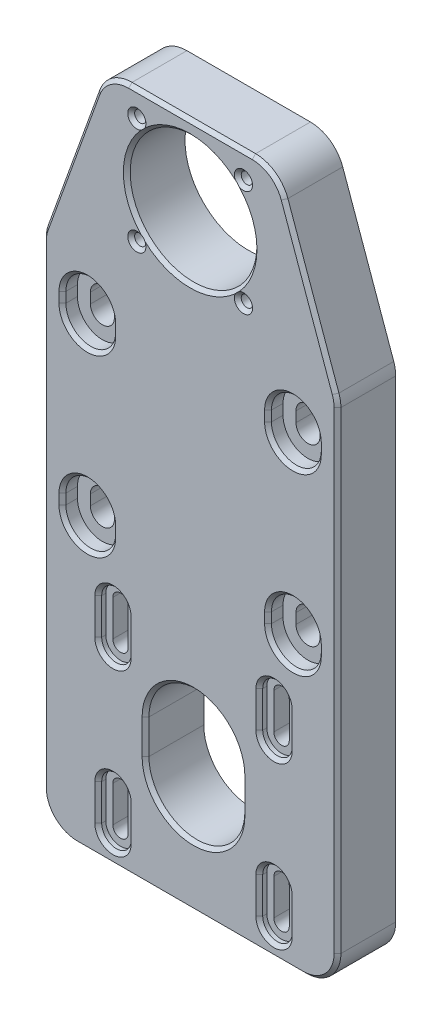
from build123d import *

# Parameters (mm, degrees)
SKETCH1_R                                = 18.5
SKETCH1_W                                = 86
SKETCH1_H                                = 77
SKETCH1_H_2                              = 72.733642247
BOSS_EXTRUDE1_DEPTH                      = 17
M4X0_7_TAPPED_HOLE1_D                    = 3.3
M4X0_7_TAPPED_HOLE1_DEPTH                = 20
M4X0_7_TAPPED_HOLE1_TIP                  = 0.991420021
CBORE_SLOT_FOR_M4_SBHCS3_DEPTH           = 17
CBORE_START                              = 14.8
CBORE_SLOT_FOR_M4_SBHCS3_2_DEPTH         = 2.2
CUT_EXTRUDE1_DEPTH                       = 138.03649149
CBORE_SLOT_FOR_M6_HEX_HEAD_BOLT1_DEPTH   = 17
CBORE_START_2                            = 12.62
CBORE_SLOT_FOR_M6_HEX_HEAD_BOLT1_2_DEPTH = 4.38
FILLET1_R                                = 10
CHAMFER1_SIZE                            = 1


# Read off the part's stored shape, not the designer's step: CBORE SLOT for M4 SBHCS3, CBORE SLOT for M6 Hex Head Bolt1
with BuildPart() as part:
    # Sketch1 → Boss-Extrude1 (new body)
    # profile 1 of 3: a face of its own
    with BuildSketch(Plane.XY):
        Polygon((14.773286703, 129), (-14.773286703, 129), (-24.97132573, 129), (-43, 79), (43, 79), (25.15845151, 129), (20.15845151, 129), align=None)
        with Locations((0, 106)):
            Circle(SKETCH1_R, mode=Mode.SUBTRACT)
    # profile 2 of 3: a face of its own
    with BuildSketch(Plane.XY):
        with Locations((0, 40.5)):
            Rectangle(SKETCH1_W, SKETCH1_H)
    # profile 3 of 3: a face of its own
    with BuildSketch(Plane.XY):
        with Locations((0, -34.366821124)):
            Rectangle(SKETCH1_W, SKETCH1_H_2)
    extrude(amount=BOSS_EXTRUDE1_DEPTH)

    # M4x0.7 Tapped Hole1
    with Locations(Plane(origin=(-15.556349182, 90.443650818, 17), x_dir=(1, 0, 0), z_dir=(0, 0, 1))):
        with Locations((0, 0), (0, 31.112698364), (31.112698364, 31.112698364), (31.112698364, 0)):
            Hole(M4X0_7_TAPPED_HOLE1_D / 2, depth=M4X0_7_TAPPED_HOLE1_DEPTH)
            with Locations((0, 0, -(M4X0_7_TAPPED_HOLE1_DEPTH + M4X0_7_TAPPED_HOLE1_TIP / 2))):  # 118° drill point
                Cone(0, M4X0_7_TAPPED_HOLE1_D / 2, M4X0_7_TAPPED_HOLE1_TIP, mode=Mode.SUBTRACT)

    # CBORE SLOT for M4 SBHCS3 outline → CBORE SLOT for M4 SBHCS3 (cut)
    with BuildSketch(Plane.XY):
        with BuildLine():
            ThreePointArc((-20.274967442, -52.200025), (-22.524967442, -49.950025), (-24.774967442, -52.200025))
            Line((-24.774967442, -52.200025), (-24.774967442, -62.700025))
            ThreePointArc((-24.774967442, -62.700025), (-22.524967442, -64.950025), (-20.274967442, -62.700025))
            Line((-20.274967442, -62.700025), (-20.274967442, -52.200025))
        make_face()
        with BuildLine():
            ThreePointArc((-20.274967442, -5.200025), (-22.524967442, -2.950025), (-24.774967442, -5.200025))
            Line((-24.774967442, -5.200025), (-24.774967442, -15.700025))
            ThreePointArc((-24.774967442, -15.700025), (-22.524967442, -17.950025), (-20.274967442, -15.700025))
            Line((-20.274967442, -15.700025), (-20.274967442, -5.200025))
        make_face()
        with BuildLine():
            ThreePointArc((22.225032558, -62.700025), (24.475032558, -64.950025), (26.725032558, -62.700025))
            Line((26.725032558, -62.700025), (26.725032558, -52.200025))
            ThreePointArc((26.725032558, -52.200025), (24.475032558, -49.950025), (22.225032558, -52.200025))
            Line((22.225032558, -52.200025), (22.225032558, -62.700025))
        make_face()
        with BuildLine():
            ThreePointArc((22.225032558, -15.700025), (24.475032558, -17.950025), (26.725032558, -15.700025))
            Line((26.725032558, -15.700025), (26.725032558, -5.200025))
            ThreePointArc((26.725032558, -5.200025), (24.475032558, -2.950025), (22.225032558, -5.200025))
            Line((22.225032558, -5.200025), (22.225032558, -15.700025))
        make_face()
    extrude(amount=CBORE_SLOT_FOR_M4_SBHCS3_DEPTH, mode=Mode.SUBTRACT)

    # CBORE SLOT for M4 SBHCS3 2 outline → CBORE SLOT for M4 SBHCS3 2 (cut)
    # profile 1 of 4: a face of its own
    with BuildSketch(Plane.XY.offset(CBORE_START)):
        with BuildLine():
            Line((-18.224967442, -62.700025), (-18.224967442, -52.200025))
            ThreePointArc((-18.224967442, -52.200025), (-22.524967442, -47.900025), (-26.824967442, -52.200025))
            Line((-26.824967442, -52.200025), (-26.824967442, -62.700025))
            ThreePointArc((-26.824967442, -62.700025), (-22.524967442, -67.000025), (-18.224967442, -62.700025))
        make_face()
        with BuildLine():
            Line((-24.774967442, -62.700025), (-24.774967442, -52.200025))
            ThreePointArc((-24.774967442, -52.200025), (-22.524967442, -49.950025), (-20.274967442, -52.200025))
            Line((-20.274967442, -52.200025), (-20.274967442, -62.700025))
            ThreePointArc((-20.274967442, -62.700025), (-22.524967442, -64.950025), (-24.774967442, -62.700025))
        make_face(mode=Mode.SUBTRACT)
    # profile 2 of 4: a face of its own
    with BuildSketch(Plane.XY.offset(CBORE_START)):
        with BuildLine():
            ThreePointArc((-18.224967442, -5.200025), (-22.524967442, -0.900025), (-26.824967442, -5.200025))
            Line((-26.824967442, -5.200025), (-26.824967442, -15.700025))
            ThreePointArc((-26.824967442, -15.700025), (-22.524967442, -20.000025), (-18.224967442, -15.700025))
            Line((-18.224967442, -15.700025), (-18.224967442, -5.200025))
        make_face()
        with BuildLine():
            Line((-24.774967442, -15.700025), (-24.774967442, -5.200025))
            ThreePointArc((-24.774967442, -5.200025), (-22.524967442, -2.950025), (-20.274967442, -5.200025))
            Line((-20.274967442, -5.200025), (-20.274967442, -15.700025))
            ThreePointArc((-20.274967442, -15.700025), (-22.524967442, -17.950025), (-24.774967442, -15.700025))
        make_face(mode=Mode.SUBTRACT)
    # profile 3 of 4: a face of its own
    with BuildSketch(Plane.XY.offset(CBORE_START)):
        with BuildLine():
            Line((28.775032558, -62.700025), (28.775032558, -52.200025))
            ThreePointArc((28.775032558, -52.200025), (24.475032558, -47.900025), (20.175032558, -52.200025))
            Line((20.175032558, -52.200025), (20.175032558, -62.700025))
            ThreePointArc((20.175032558, -62.700025), (24.475032558, -67.000025), (28.775032558, -62.700025))
        make_face()
        with BuildLine():
            Line((26.725032558, -52.200025), (26.725032558, -62.700025))
            ThreePointArc((26.725032558, -62.700025), (24.475032558, -64.950025), (22.225032558, -62.700025))
            Line((22.225032558, -62.700025), (22.225032558, -52.200025))
            ThreePointArc((22.225032558, -52.200025), (24.475032558, -49.950025), (26.725032558, -52.200025))
        make_face(mode=Mode.SUBTRACT)
    # profile 4 of 4: a face of its own
    with BuildSketch(Plane.XY.offset(CBORE_START)):
        with BuildLine():
            ThreePointArc((28.775032558, -5.200025), (24.475032558, -0.900025), (20.175032558, -5.200025))
            Line((20.175032558, -5.200025), (20.175032558, -15.700025))
            ThreePointArc((20.175032558, -15.700025), (24.475032558, -20.000025), (28.775032558, -15.700025))
            Line((28.775032558, -15.700025), (28.775032558, -5.200025))
        make_face()
        with BuildLine():
            Line((26.725032558, -5.200025), (26.725032558, -15.700025))
            ThreePointArc((26.725032558, -15.700025), (24.475032558, -17.950025), (22.225032558, -15.700025))
            Line((22.225032558, -15.700025), (22.225032558, -5.200025))
            ThreePointArc((22.225032558, -5.200025), (24.475032558, -2.950025), (26.725032558, -5.200025))
        make_face(mode=Mode.SUBTRACT)
    extrude(amount=CBORE_SLOT_FOR_M4_SBHCS3_2_DEPTH, mode=Mode.SUBTRACT)

    # Sketch13 → Cut-Extrude1 (cut, through all)
    with BuildSketch(Plane.XY.offset(17)):
        with BuildLine():
            Line((14.975032558, -28.950025), (14.975032558, -38.950025))
            ThreePointArc((14.975032558, -38.950025), (0.975032558, -52.950025), (-13.024967442, -38.950025))
            Line((-13.024967442, -38.950025), (-13.024967442, -28.950025))
            ThreePointArc((-13.024967442, -28.950025), (0.975032558, -14.950025), (14.975032558, -28.950025))
        make_face()
    extrude(amount=-CUT_EXTRUDE1_DEPTH, mode=Mode.SUBTRACT)

    # CBORE SLOT for M6 Hex Head Bolt1 outline → CBORE SLOT for M6 Hex Head Bolt1 (cut)
    with BuildSketch(Plane.XY):
        with BuildLine():
            ThreePointArc((33.5, 15.5), (30, 19), (26.5, 15.5))
            Line((26.5, 15.5), (26.5, 12.5))
            ThreePointArc((26.5, 12.5), (30, 9), (33.5, 12.5))
            Line((33.5, 12.5), (33.5, 15.5))
        make_face()
        with BuildLine():
            ThreePointArc((33.5, 66.5), (30, 70), (26.5, 66.5))
            Line((26.5, 66.5), (26.5, 63.5))
            ThreePointArc((26.5, 63.5), (30, 60), (33.5, 63.5))
            Line((33.5, 63.5), (33.5, 66.5))
        make_face()
        with BuildLine():
            ThreePointArc((-26.5, 15.5), (-30, 19), (-33.5, 15.5))
            Line((-33.5, 15.5), (-33.5, 12.5))
            ThreePointArc((-33.5, 12.5), (-30, 9), (-26.5, 12.5))
            Line((-26.5, 12.5), (-26.5, 15.5))
        make_face()
        with BuildLine():
            ThreePointArc((-26.5, 66.5), (-30, 70), (-33.5, 66.5))
            Line((-33.5, 66.5), (-33.5, 63.5))
            ThreePointArc((-33.5, 63.5), (-30, 60), (-26.5, 63.5))
            Line((-26.5, 63.5), (-26.5, 66.5))
        make_face()
    extrude(amount=CBORE_SLOT_FOR_M6_HEX_HEAD_BOLT1_DEPTH, mode=Mode.SUBTRACT)

    # CBORE SLOT for M6 Hex Head Bolt1 2 outli → CBORE SLOT for M6 Hex Head Bolt1 2 (cut)
    # profile 1 of 4: a face of its own
    with BuildSketch(Plane.XY.offset(CBORE_START_2)):
        with BuildLine():
            Line((37.275, 12.5), (37.275, 15.5))
            ThreePointArc((37.275, 15.5), (30, 22.775), (22.725, 15.5))
            Line((22.725, 15.5), (22.725, 12.5))
            ThreePointArc((22.725, 12.5), (30, 5.225), (37.275, 12.5))
        make_face()
        with BuildLine():
            Line((26.5, 12.5), (26.5, 15.5))
            ThreePointArc((26.5, 15.5), (30, 19), (33.5, 15.5))
            Line((33.5, 15.5), (33.5, 12.5))
            ThreePointArc((33.5, 12.5), (30, 9), (26.5, 12.5))
        make_face(mode=Mode.SUBTRACT)
    # profile 2 of 4: a face of its own
    with BuildSketch(Plane.XY.offset(CBORE_START_2)):
        with BuildLine():
            ThreePointArc((37.275, 66.5), (30, 73.775), (22.725, 66.5))
            Line((22.725, 66.5), (22.725, 63.5))
            ThreePointArc((22.725, 63.5), (30, 56.225), (37.275, 63.5))
            Line((37.275, 63.5), (37.275, 66.5))
        make_face()
        with BuildLine():
            Line((26.5, 63.5), (26.5, 66.5))
            ThreePointArc((26.5, 66.5), (30, 70), (33.5, 66.5))
            Line((33.5, 66.5), (33.5, 63.5))
            ThreePointArc((33.5, 63.5), (30, 60), (26.5, 63.5))
        make_face(mode=Mode.SUBTRACT)
    # profile 3 of 4: a face of its own
    with BuildSketch(Plane.XY.offset(CBORE_START_2)):
        with BuildLine():
            Line((-22.725, 12.5), (-22.725, 15.5))
            ThreePointArc((-22.725, 15.5), (-30, 22.775), (-37.275, 15.5))
            Line((-37.275, 15.5), (-37.275, 12.5))
            ThreePointArc((-37.275, 12.5), (-30, 5.225), (-22.725, 12.5))
        make_face()
        with BuildLine():
            Line((-33.5, 12.5), (-33.5, 15.5))
            ThreePointArc((-33.5, 15.5), (-30, 19), (-26.5, 15.5))
            Line((-26.5, 15.5), (-26.5, 12.5))
            ThreePointArc((-26.5, 12.5), (-30, 9), (-33.5, 12.5))
        make_face(mode=Mode.SUBTRACT)
    # profile 4 of 4: a face of its own
    with BuildSketch(Plane.XY.offset(CBORE_START_2)):
        with BuildLine():
            ThreePointArc((-22.725, 66.5), (-30, 73.775), (-37.275, 66.5))
            Line((-37.275, 66.5), (-37.275, 63.5))
            ThreePointArc((-37.275, 63.5), (-30, 56.225), (-22.725, 63.5))
            Line((-22.725, 63.5), (-22.725, 66.5))
        make_face()
        with BuildLine():
            Line((-33.5, 63.5), (-33.5, 66.5))
            ThreePointArc((-33.5, 66.5), (-30, 70), (-26.5, 66.5))
            Line((-26.5, 66.5), (-26.5, 63.5))
            ThreePointArc((-26.5, 63.5), (-30, 60), (-33.5, 63.5))
        make_face(mode=Mode.SUBTRACT)
    extrude(amount=CBORE_SLOT_FOR_M6_HEX_HEAD_BOLT1_2_DEPTH, mode=Mode.SUBTRACT)

    # Fillet1
    fillet1_edges = [part.edges().sort_by_distance(p)[0] for p in [
        (-43, 79, 8.5),
        (-24.97132573, 129, 8.5),
        (25.15845151, 129, 8.5),
        (43, 79, 8.5),
        (43, -70.733642247, 8.5),
        (-43, -70.733642247, 8.5),
    ]]
    fillet(fillet1_edges, radius=FILLET1_R)

    # Chamfer1
    # the kernel refuses this chamfer: 1 mm, written as the material it takes off along each edge
    with BuildSketch(Plane(origin=(28.775032558, -15.700025, 17), x_dir=(0.9996219169112968, 0, 0.027495876610585647), z_dir=(0, 1, 0)), Plane(origin=(20.175032558, -5.200025, 17), x_dir=(-0.9996219169112968, 0, 0.027495876610585647), z_dir=(0, -1, 0)), Plane(origin=(-18.224967442, -15.700025, 17), x_dir=(0.9996219169112968, 0, 0.027495876610585647), z_dir=(0, 1, 0)), Plane(origin=(-26.824967442, -5.200025, 17), x_dir=(-0.9996219169112968, 0, 0.027495876610585647), z_dir=(0, -1, 0)), Plane(origin=(-18.224967442, -62.700025, 17), x_dir=(0.9996219169112968, 0, 0.027495876610585647), z_dir=(0, 1, 0)), Plane(origin=(-26.824967442, -52.200025, 17), x_dir=(-0.9996219169112968, 0, 0.027495876610585647), z_dir=(0, -1, 0)), Plane(origin=(28.775032558, -62.700025, 17), x_dir=(0.9996219169112968, 0, 0.027495876610585647), z_dir=(0, 1, 0)), Plane(origin=(20.175032558, -52.200025, 17), x_dir=(-0.9996219169112968, 0, 0.027495876610585647), z_dir=(0, -1, 0))) as chamfer1_piece_1:
        Polygon((CHAMFER1_SIZE * 0.999621916911, CHAMFER1_SIZE * 0.0274958766106), (-CHAMFER1_SIZE * 0.0274958766106, CHAMFER1_SIZE * 0.999621916911), (0, 0), align=None)
    extrude(amount=10.5, mode=Mode.SUBTRACT)
    with BuildSketch(Plane(origin=(24.475032558, -5.200025, 17), x_dir=(1, 0, 0), z_dir=(0, -1, 0))) as chamfer1_piece_2:
        Polygon((4.3 + CHAMFER1_SIZE, 0), (4.3, -CHAMFER1_SIZE), (4.3, 0), align=None)
    revolve(axis=Axis((24.475032558, -5.200025, 17), (0, 0, 1)), revolution_arc=180, mode=Mode.SUBTRACT)
    with BuildSketch(Plane(origin=(24.475032558, -15.700025, 17), x_dir=(-1, 0, 0), z_dir=(0, 1, 0))) as chamfer1_piece_3:
        Polygon((4.3 + CHAMFER1_SIZE, 0), (4.3, -CHAMFER1_SIZE), (4.3, 0), align=None)
    revolve(axis=Axis((24.475032558, -15.700025, 17), (0, 0, 1)), revolution_arc=180, mode=Mode.SUBTRACT)
    with BuildSketch(Plane(origin=(-22.524967442, -5.200025, 17), x_dir=(1, 0, 0), z_dir=(0, -1, 0))) as chamfer1_piece_4:
        Polygon((4.3 + CHAMFER1_SIZE, 0), (4.3, -CHAMFER1_SIZE), (4.3, 0), align=None)
    revolve(axis=Axis((-22.524967442, -5.200025, 17), (0, 0, 1)), revolution_arc=180, mode=Mode.SUBTRACT)
    with BuildSketch(Plane(origin=(-22.524967442, -15.700025, 17), x_dir=(-1, 0, 0), z_dir=(0, 1, 0))) as chamfer1_piece_5:
        Polygon((4.3 + CHAMFER1_SIZE, 0), (4.3, -CHAMFER1_SIZE), (4.3, 0), align=None)
    revolve(axis=Axis((-22.524967442, -15.700025, 17), (0, 0, 1)), revolution_arc=180, mode=Mode.SUBTRACT)
    with BuildSketch(Plane(origin=(0.975032558, -28.950025, 17), x_dir=(-1, 0, 0), z_dir=(0, -1, 0))) as chamfer1_piece_6:
        Polygon((14 + CHAMFER1_SIZE, 0), (14, CHAMFER1_SIZE), (14, 0), align=None)
    revolve(axis=Axis((0.975032558, -28.950025, 17), (0, 0, -1)), revolution_arc=180, mode=Mode.SUBTRACT)
    with BuildSketch(Plane(origin=(-13.024967442, -38.950025, 17), x_dir=(-0.9996219169112968, 0, 0.027495876610585647), z_dir=(0, 1, 0)), Plane(origin=(14.975032558, -28.950025, 17), x_dir=(0.9996219169112968, 0, 0.027495876610585647), z_dir=(0, -1, 0))) as chamfer1_piece_7:
        Polygon((CHAMFER1_SIZE * 0.999621916911, -CHAMFER1_SIZE * 0.0274958766106), (-CHAMFER1_SIZE * 0.0274958766106, -CHAMFER1_SIZE * 0.999621916911), (0, 0), align=None)
    extrude(amount=10, mode=Mode.SUBTRACT)
    with BuildSketch(Plane(origin=(0.975032558, -38.950025, 17), x_dir=(1, 0, 0), z_dir=(0, 1, 0))) as chamfer1_piece_8:
        Polygon((14 + CHAMFER1_SIZE, 0), (14, CHAMFER1_SIZE), (14, 0), align=None)
    revolve(axis=Axis((0.975032558, -38.950025, 17), (0, 0, -1)), revolution_arc=180, mode=Mode.SUBTRACT)
    with BuildSketch(Plane(origin=(37.275, 12.5, 17), x_dir=(0.9996219169112968, 0, 0.02749587661058555), z_dir=(0, 1, 0)), Plane(origin=(22.725, 15.5, 17), x_dir=(-0.9996219169112968, 0, 0.027495876610585647), z_dir=(0, -1, 0)), Plane(origin=(-22.725, 12.5, 17), x_dir=(0.9996219169112968, 0, 0.027495876610585647), z_dir=(0, 1, 0)), Plane(origin=(-37.275, 15.5, 17), x_dir=(-0.9996219169112968, 0, 0.02749587661058555), z_dir=(0, -1, 0)), Plane(origin=(-22.725, 63.5, 17), x_dir=(0.9996219169112968, 0, 0.027495876610585647), z_dir=(0, 1, 0)), Plane(origin=(-37.275, 66.5, 17), x_dir=(-0.9996219169112968, 0, 0.02749587661058555), z_dir=(0, -1, 0)), Plane(origin=(37.275, 63.5, 17), x_dir=(0.9996219169112968, 0, 0.02749587661058555), z_dir=(0, 1, 0)), Plane(origin=(22.725, 66.5, 17), x_dir=(-0.9996219169112968, 0, 0.027495876610585647), z_dir=(0, -1, 0))) as chamfer1_piece_9:
        Polygon((CHAMFER1_SIZE * 0.999621916911, CHAMFER1_SIZE * 0.0274958766106), (-CHAMFER1_SIZE * 0.0274958766106, CHAMFER1_SIZE * 0.999621916911), (0, 0), align=None)
    extrude(amount=3, mode=Mode.SUBTRACT)
    with BuildSketch(Plane(origin=(30, 15.5, 17), x_dir=(1, 0, 0), z_dir=(0, -1, 0))) as chamfer1_piece_10:
        Polygon((7.275 + CHAMFER1_SIZE, 0), (7.275, -CHAMFER1_SIZE), (7.275, 0), align=None)
    revolve(axis=Axis((30, 15.5, 17), (0, 0, 1)), revolution_arc=180, mode=Mode.SUBTRACT)
    with BuildSketch(Plane(origin=(30, 12.5, 17), x_dir=(-1, 0, 0), z_dir=(0, 1, 0))) as chamfer1_piece_11:
        Polygon((7.275 + CHAMFER1_SIZE, 0), (7.275, -CHAMFER1_SIZE), (7.275, 0), align=None)
    revolve(axis=Axis((30, 12.5, 17), (0, 0, 1)), revolution_arc=180, mode=Mode.SUBTRACT)
    with BuildSketch(Plane(origin=(-30, 15.5, 17), x_dir=(1, 0, 0), z_dir=(0, -1, 0))) as chamfer1_piece_12:
        Polygon((7.275 + CHAMFER1_SIZE, 0), (7.275, -CHAMFER1_SIZE), (7.275, 0), align=None)
    revolve(axis=Axis((-30, 15.5, 17), (0, 0, 1)), revolution_arc=180, mode=Mode.SUBTRACT)
    with BuildSketch(Plane(origin=(-30, 12.5, 17), x_dir=(-1, 0, 0), z_dir=(0, 1, 0))) as chamfer1_piece_13:
        Polygon((7.275 + CHAMFER1_SIZE, 0), (7.275, -CHAMFER1_SIZE), (7.275, 0), align=None)
    revolve(axis=Axis((-30, 12.5, 17), (0, 0, 1)), revolution_arc=180, mode=Mode.SUBTRACT)
    with BuildSketch(Plane(origin=(-30, 66.5, 17), x_dir=(1, 0, 0), z_dir=(0, -1, 0))) as chamfer1_piece_14:
        Polygon((7.275 + CHAMFER1_SIZE, 0), (7.275, -CHAMFER1_SIZE), (7.275, 0), align=None)
    revolve(axis=Axis((-30, 66.5, 17), (0, 0, 1)), revolution_arc=180, mode=Mode.SUBTRACT)
    with BuildSketch(Plane(origin=(-30, 63.5, 17), x_dir=(-1, 0, 0), z_dir=(0, 1, 0))) as chamfer1_piece_15:
        Polygon((7.275 + CHAMFER1_SIZE, 0), (7.275, -CHAMFER1_SIZE), (7.275, 0), align=None)
    revolve(axis=Axis((-30, 63.5, 17), (0, 0, 1)), revolution_arc=180, mode=Mode.SUBTRACT)
    with BuildSketch(Plane(origin=(30, 66.5, 17), x_dir=(1, 0, 0), z_dir=(0, -1, 0))) as chamfer1_piece_16:
        Polygon((7.275 + CHAMFER1_SIZE, 0), (7.275, -CHAMFER1_SIZE), (7.275, 0), align=None)
    revolve(axis=Axis((30, 66.5, 17), (0, 0, 1)), revolution_arc=180, mode=Mode.SUBTRACT)
    with BuildSketch(Plane(origin=(30, 63.5, 17), x_dir=(-1, 0, 0), z_dir=(0, 1, 0))) as chamfer1_piece_17:
        Polygon((7.275 + CHAMFER1_SIZE, 0), (7.275, -CHAMFER1_SIZE), (7.275, 0), align=None)
    revolve(axis=Axis((30, 63.5, 17), (0, 0, 1)), revolution_arc=180, mode=Mode.SUBTRACT)
    with BuildSketch(Plane(origin=(42.418349174, 80.630045807, 17), x_dir=(-0.9414788255482561, -0.33594880236978336, 0.027495876610585532), z_dir=(-0.3360758669716067, 0.9418349174028764, 0))) as chamfer1_piece_18:
        Polygon((CHAMFER1_SIZE * 0.999621916911, -CHAMFER1_SIZE * 0.0274958766106), (-CHAMFER1_SIZE * 0.0274958766106, -CHAMFER1_SIZE * 0.999621916911), (0, 0), align=None)
    extrude(amount=44.307884633, mode=Mode.SUBTRACT)
    with BuildSketch(Plane(origin=(15.556349182, 90.443650818, 17), x_dir=(-1, 0, 0), z_dir=(0, -1, 0))) as chamfer1_piece_19:
        Polygon((1.65 + CHAMFER1_SIZE, 0), (1.65, CHAMFER1_SIZE), (1.65, 0), align=None)
    revolve(axis=Axis((15.556349182, 90.443650818, 17), (0, 0, -1)), mode=Mode.SUBTRACT)
    with BuildSketch(Plane(origin=(43, -60.733642247, 17), x_dir=(-0.9996219169112968, 0, 0.02749587661058555), z_dir=(0, 1, 0))) as chamfer1_piece_20:
        Polygon((CHAMFER1_SIZE * 0.999621916911, -CHAMFER1_SIZE * 0.0274958766106), (-CHAMFER1_SIZE * 0.0274958766106, -CHAMFER1_SIZE * 0.999621916911), (0, 0), align=None)
    extrude(amount=138.002929384, mode=Mode.SUBTRACT)
    with BuildSketch(Plane(origin=(-43, 77.25220626, 17), x_dir=(0.9996219169112968, 0, 0.02749587661058555), z_dir=(0, -1, 0))) as chamfer1_piece_21:
        Polygon((CHAMFER1_SIZE * 0.999621916911, -CHAMFER1_SIZE * 0.0274958766106), (-CHAMFER1_SIZE * 0.0274958766106, -CHAMFER1_SIZE * 0.999621916911), (0, 0), align=None)
    extrude(amount=137.985848507, mode=Mode.SUBTRACT)
    with BuildSketch(Plane(origin=(-33, -70.733642247, 17), x_dir=(0, 0.9996219169112968, 0.02749587661058574), z_dir=(1, 0, 0))) as chamfer1_piece_22:
        Polygon((CHAMFER1_SIZE * 0.999621916911, -CHAMFER1_SIZE * 0.0274958766106), (-CHAMFER1_SIZE * 0.0274958766106, -CHAMFER1_SIZE * 0.999621916911), (0, 0), align=None)
    extrude(amount=66, mode=Mode.SUBTRACT)
    with BuildSketch(Plane(origin=(-17.946852503, 129, 17), x_dir=(0, 0.0274958766105822, -0.999621916911297), z_dir=(1, 0, 0))) as chamfer1_piece_23:
        Polygon((CHAMFER1_SIZE * 0.999621916911, -CHAMFER1_SIZE * 0.0274958766106), (-CHAMFER1_SIZE * 0.0274958766106, -CHAMFER1_SIZE * 0.999621916911), (0, 0), align=None)
    extrude(amount=36.056041762, mode=Mode.SUBTRACT)
    with BuildSketch(Plane(origin=(-27.354006083, 122.391970154, 17), x_dir=(0.9403596894143853, -0.33906877074407227, 0.027495876610585616), z_dir=(-0.3391970153993334, -0.9407153579825219, 0))) as chamfer1_piece_24:
        Polygon((CHAMFER1_SIZE * 0.999621916911, -CHAMFER1_SIZE * 0.0274958766106), (-CHAMFER1_SIZE * 0.0274958766106, -CHAMFER1_SIZE * 0.999621916911), (0, 0), align=None)
    extrude(amount=44.378773436, mode=Mode.SUBTRACT)
    with BuildSketch(Plane(origin=(33, -60.733642247, 17), x_dir=(0, -1, 0), z_dir=(-1, 0, 0))) as chamfer1_piece_25:
        Polygon((10 - CHAMFER1_SIZE, 0), (10, -CHAMFER1_SIZE), (10, 0), align=None)
    revolve(axis=Axis((33, -60.733642247, 17), (0, 0, 1)), revolution_arc=90, mode=Mode.SUBTRACT)
    with BuildSketch(Plane(origin=(-33, -60.733642247, 17), x_dir=(-1, 0, 0), z_dir=(0, 1, 0))) as chamfer1_piece_26:
        Polygon((10 - CHAMFER1_SIZE, 0), (10, -CHAMFER1_SIZE), (10, 0), align=None)
    revolve(axis=Axis((-33, -60.733642247, 17), (0, 0, 1)), revolution_arc=90, mode=Mode.SUBTRACT)
    with BuildSketch(Plane(origin=(-33, 77.25220626, 17), x_dir=(-0.9407153579825221, 0.3391970153993328, 0), z_dir=(0.3391970153993328, 0.9407153579825221, 0))) as chamfer1_piece_27:
        Polygon((10 - CHAMFER1_SIZE, 0), (10, -CHAMFER1_SIZE), (10, 0), align=None)
    revolve(axis=Axis((-33, 77.25220626, 17), (0, 0, 1)), revolution_arc=19.827959469, mode=Mode.SUBTRACT)
    with BuildSketch(Plane(origin=(-17.946852503, 119, 17), x_dir=(0, 1, 0), z_dir=(1, 0, 0))) as chamfer1_piece_28:
        Polygon((10, -CHAMFER1_SIZE), (10 - CHAMFER1_SIZE, 0), (10, 0), align=None)
    revolve(axis=Axis((-17.946852503, 119, 17), (0, 0, 1)), revolution_arc=70.172040531, mode=Mode.SUBTRACT)
    with BuildSketch(Plane(origin=(18.109189258, 119, 17), x_dir=(0, 1, 0), z_dir=(-1, 0, 0))) as chamfer1_piece_29:
        Polygon((10, CHAMFER1_SIZE), (10 - CHAMFER1_SIZE, 0), (10, 0), align=None)
    revolve(axis=Axis((18.109189258, 119, 17), (0, 0, -1)), revolution_arc=70.362025862, mode=Mode.SUBTRACT)
    with BuildSketch(Plane(origin=(33, 77.269287137, 17), x_dir=(0.9418349174028765, 0.3360758669716064, 0), z_dir=(-0.3360758669716064, 0.9418349174028765, 0))) as chamfer1_piece_30:
        Polygon((10 - CHAMFER1_SIZE, 0), (10, CHAMFER1_SIZE), (10, 0), align=None)
    revolve(axis=Axis((33, 77.269287137, 17), (0, 0, -1)), revolution_arc=19.637974138, mode=Mode.SUBTRACT)
    with BuildSketch(Plane(origin=(15.556349182, 121.556349182, 17), x_dir=(-1, 0, 0), z_dir=(0, -1, 0))) as chamfer1_piece_31:
        Polygon((1.65 + CHAMFER1_SIZE, 0), (1.65, CHAMFER1_SIZE), (1.65, 0), align=None)
    revolve(axis=Axis((15.556349182, 121.556349182, 17), (0, 0, -1)), mode=Mode.SUBTRACT)
    with BuildSketch(Plane(origin=(-15.556349182, 121.556349182, 17), x_dir=(-1, 0, 0), z_dir=(0, -1, 0))) as chamfer1_piece_32:
        Polygon((1.65 + CHAMFER1_SIZE, 0), (1.65, CHAMFER1_SIZE), (1.65, 0), align=None)
    revolve(axis=Axis((-15.556349182, 121.556349182, 17), (0, 0, -1)), mode=Mode.SUBTRACT)
    with BuildSketch(Plane(origin=(-15.556349182, 90.443650818, 17), x_dir=(-1, 0, 0), z_dir=(0, -1, 0))) as chamfer1_piece_33:
        Polygon((1.65 + CHAMFER1_SIZE, 0), (1.65, CHAMFER1_SIZE), (1.65, 0), align=None)
    revolve(axis=Axis((-15.556349182, 90.443650818, 17), (0, 0, -1)), mode=Mode.SUBTRACT)
    with BuildSketch(Plane(origin=(-22.524967442, -52.200025, 17), x_dir=(1, 0, 0), z_dir=(0, -1, 0))) as chamfer1_piece_34:
        Polygon((4.3 + CHAMFER1_SIZE, 0), (4.3, -CHAMFER1_SIZE), (4.3, 0), align=None)
    revolve(axis=Axis((-22.524967442, -52.200025, 17), (0, 0, 1)), revolution_arc=180, mode=Mode.SUBTRACT)
    with BuildSketch(Plane(origin=(-22.524967442, -62.700025, 17), x_dir=(-1, 0, 0), z_dir=(0, 1, 0))) as chamfer1_piece_35:
        Polygon((4.3 + CHAMFER1_SIZE, 0), (4.3, -CHAMFER1_SIZE), (4.3, 0), align=None)
    revolve(axis=Axis((-22.524967442, -62.700025, 17), (0, 0, 1)), revolution_arc=180, mode=Mode.SUBTRACT)
    with BuildSketch(Plane(origin=(0, 106, 17), x_dir=(1, 0, 0), z_dir=(0, -1, 0))) as chamfer1_piece_36:
        Polygon((18.5 + CHAMFER1_SIZE, 0), (18.5, -CHAMFER1_SIZE), (18.5, 0), align=None)
    revolve(axis=Axis((0, 106, 17), (0, 0, 1)), mode=Mode.SUBTRACT)
    with BuildSketch(Plane(origin=(24.475032558, -52.200025, 17), x_dir=(1, 0, 0), z_dir=(0, -1, 0))) as chamfer1_piece_37:
        Polygon((4.3 + CHAMFER1_SIZE, 0), (4.3, -CHAMFER1_SIZE), (4.3, 0), align=None)
    revolve(axis=Axis((24.475032558, -52.200025, 17), (0, 0, 1)), revolution_arc=180, mode=Mode.SUBTRACT)
    with BuildSketch(Plane(origin=(24.475032558, -62.700025, 17), x_dir=(-1, 0, 0), z_dir=(0, 1, 0))) as chamfer1_piece_38:
        Polygon((4.3 + CHAMFER1_SIZE, 0), (4.3, -CHAMFER1_SIZE), (4.3, 0), align=None)
    revolve(axis=Axis((24.475032558, -62.700025, 17), (0, 0, 1)), revolution_arc=180, mode=Mode.SUBTRACT)


solid = part.part
